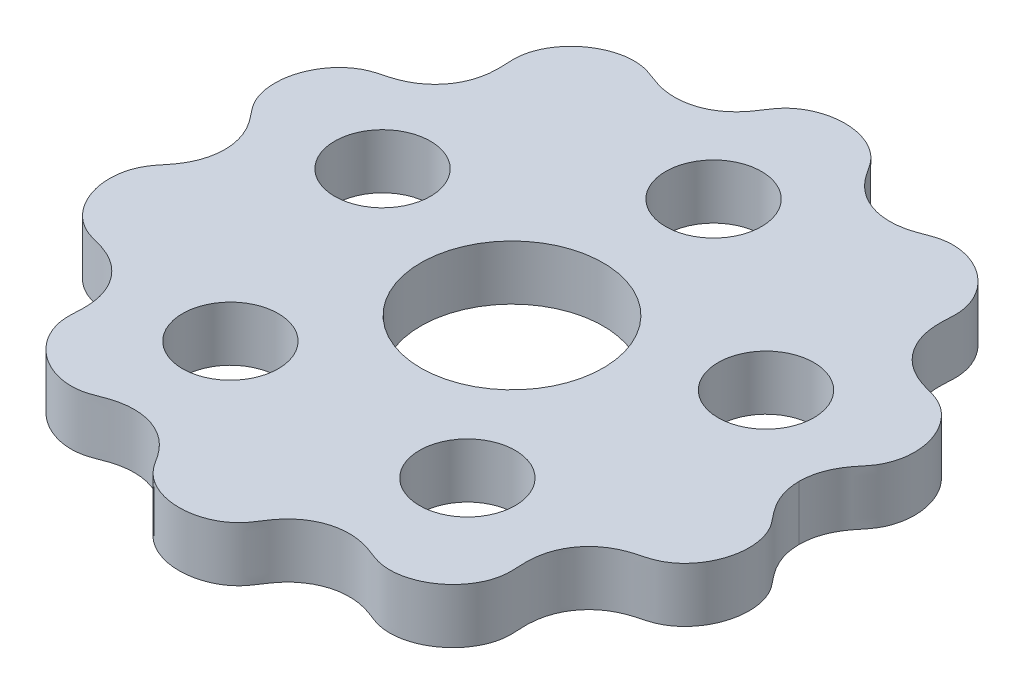
from build123d import *

# Parameters (mm, degrees)
BOSS_EXTRUDE2_DEPTH = 6
SKETCH8_R           = 5.25
SKETCH8_R_2         = 10
CUT_EXTRUDE1_DEPTH  = 15


# Read off the part's stored shape, not the designer's step: Boss-Extrude2
with BuildPart() as part:
    # Boss-Extrude2 outline → Boss-Extrude2 (new body)
    with BuildSketch(Plane(origin=(0, 0, 0), x_dir=(1, 0, 0), z_dir=(0, 1, 0))):
        with BuildLine():
            add(Edge.make_bspline(
                [(-31.499993504, 0), (-31.499993419, -0.00604861), (-31.50038656, -0.331222159), (-31.543529646, -0.975447868), (-31.720841141, -1.86242283), (-32.141813755, -2.935555351), (-32.690034798, -3.873745201), (-33.307897052, -4.685007547), (-33.913183196, -5.38319735), (-34.361423558, -6.084216031), (-34.663951399, -6.753375858), (-34.861884865, -7.360852844), (-35.040837742, -8.200861452), (-35.112861284, -9.280386882), (-34.96942898, -10.589620807), (-34.484356858, -12.060394501), (-33.812574702, -13.2069754), (-33.091935075, -14.043880698), (-32.433167143, -14.613787937), (-31.906553334, -14.97837614), (-31.259202182, -15.328922299), (-30.476556206, -15.611601701), (-29.576048481, -15.817978522), (-28.603486754, -16.125966833), (-27.615334966, -16.579365945), (-26.654208043, -17.219734538), (-25.779503529, -18.059248358), (-25.049455366, -19.096428499), (-24.555617668, -20.192114936), (-24.274390159, -21.290953441), (-24.169343307, -22.362975244), (-24.194048583, -23.3818518), (-24.272277679, -24.297501934), (-24.22204854, -25.118528202), (-24.077190933, -25.823973525), (-23.888393636, -26.414977622), (-23.624178999, -27.020042218), (-23.278791803, -27.629537082), (-22.732658436, -28.38965416), (-21.922352281, -29.225019964), (-20.825187152, -30.015729577), (-19.615201803, -30.548970617), (-18.55366793, -30.805984952), (-17.682998284, -30.886193311), (-17.024199682, -30.873951656), (-16.280427126, -30.776191349), (-15.472502635, -30.541053046), (-14.618367559, -30.176668488), (-13.64975963, -29.855600754), (-12.574174193, -29.641503211), (-11.401229274, -29.598214263), (-10.175069451, -29.776019818), (-8.948580224, -30.212814968), (-7.894719665, -30.83925516), (-7.025705572, -31.589359041), (-6.320984457, -32.412458415), (-5.757258901, -33.258730106), (-5.273058589, -34.043636024), (-4.725893182, -34.66763204), (-4.053271763, -35.250077039), (-3.204594881, -35.791325942), (-2.078426192, -36.257650554), (-0.847460094, -36.497301275), (0.277775766, -36.523106962), (1.412122853, -36.392471929), (2.310868949, -36.155991526), (3.130672847, -35.810642797), (3.856106157, -35.373648518), (4.346805755, -35.005036367), (4.865006719, -34.522072188), (5.371511978, -33.896516796), (5.835413279, -33.129593461), (6.398728076, -32.313866645), (7.094167258, -31.523769895), (7.945813189, -30.806623471), (8.978669327, -30.201322987), (10.18580069, -29.774506124), (11.401172088, -29.598195906), (12.574210653, -29.641514683), (13.649734591, -29.855593263), (14.618384312, -30.176672775), (15.472494021, -30.541052054), (16.280430851, -30.776190175), (17.02419909, -30.873955043), (17.682996136, -30.886186775), (18.553673497, -30.805997522), (19.615190622, -30.548947207), (20.825207419, -30.015770951), (22.081497826, -29.110228874), (22.968958631, -28.128296522), (23.546146407, -27.198942866), (23.888371532, -26.414933393), (24.077203873, -25.823999416), (24.222040012, -25.118511141), (24.272284078, -24.297514737), (24.194044591, -23.381843813), (24.16934539, -22.362979412), (24.274389118, -21.290951357), (24.555618274, -20.192116148), (25.049454993, -19.096427752), (25.779503766, -18.059248834), (26.654207893, -17.219734238), (27.615335064, -16.579366141), (28.603486687, -16.1259667), (29.576048527, -15.817978613), (30.476556179, -15.611601649), (31.259202197, -15.328922327), (31.906553325, -14.978376124), (32.43316715, -14.613787947), (33.091935066, -14.043880688), (33.812574717, -13.206975413), (34.484356834, -12.060394481), (34.969429016, -10.589620836), (35.112861237, -9.280386846), (35.040837808, -8.200861503), (34.86188476, -7.360852764), (34.663951614, -6.753376022), (34.36142315, -6.08421572), (33.913183962, -5.383197934), (33.307895638, -4.68500647), (32.690036895, -3.873746798), (32.141810592, -2.935552943), (31.720845785, -1.862426365), (31.543525655, -0.975444663), (31.500386236, -0.331221533), (31.499994445, -0.006048791), (31.499994555, 0)],
                knots=[0.115426791, 0.115426791, 0.115426791, 0.115426791, 0.115426791, 0.115579116, 0.123615817, 0.131652517, 0.13806522, 0.144477922, 0.150890625, 0.157303327, 0.161318066, 0.165332805, 0.169347544, 0.173362283, 0.182908916, 0.192455548, 0.202269911, 0.212084274, 0.216110468, 0.220136661, 0.224162855, 0.228189049, 0.234599883, 0.241010717, 0.247421551, 0.253832385, 0.261894552, 0.269956719, 0.27776685, 0.28557698, 0.291986229, 0.298395477, 0.304804726, 0.311213975, 0.315112418, 0.319010861, 0.322909305, 0.326807748, 0.331713694, 0.336619639, 0.34643153, 0.355979871, 0.365528211, 0.369669846, 0.373811481, 0.377953116, 0.382094751, 0.388507083, 0.394919415, 0.401331747, 0.40774408, 0.416038981, 0.424333883, 0.432328324, 0.440322764, 0.446722382, 0.453122, 0.459521617, 0.465921235, 0.469914746, 0.473908258, 0.48189528, 0.491151437, 0.500407593, 0.505268423, 0.510129254, 0.519850916, 0.523707887, 0.527564857, 0.531421828, 0.535278799, 0.541512909, 0.547747018, 0.553981128, 0.560215238, 0.567940672, 0.575666107, 0.583961009, 0.59225591, 0.598668243, 0.605080575, 0.611492907, 0.617905239, 0.622046874, 0.626188509, 0.630330144, 0.634471779, 0.644020119, 0.65356846, 0.663380351, 0.673192242, 0.677090685, 0.680989129, 0.684887572, 0.688786015, 0.695195264, 0.701604513, 0.708013761, 0.71442301, 0.72223314, 0.730043271, 0.738105438, 0.746167605, 0.752578439, 0.758989273, 0.765400107, 0.771810941, 0.775837135, 0.779863329, 0.783889522, 0.787915716, 0.797730079, 0.807544442, 0.817091074, 0.826637707, 0.830652446, 0.834667185, 0.838681924, 0.842696663, 0.849109365, 0.855522068, 0.86193477, 0.868347472, 0.876384173, 0.884420874, 0.884573204, 0.884573204, 0.884573204, 0.884573204, 0.884573204], degree=4))
            add(Edge.make_bspline(
                [(31.499994555, 0), (31.499994445, 0.006048791), (31.500386236, 0.331221533), (31.543525655, 0.975444663), (31.720845785, 1.862426365), (32.141810592, 2.935552943), (32.690036895, 3.873746798), (33.307895638, 4.68500647), (33.913183962, 5.383197934), (34.36142315, 6.08421572), (34.663951614, 6.753376022), (34.86188476, 7.360852764), (35.040837808, 8.200861503), (35.112861237, 9.280386846), (34.969429016, 10.589620836), (34.484356834, 12.060394481), (33.812574717, 13.206975413), (33.091935066, 14.043880688), (32.43316715, 14.613787947), (31.906553325, 14.978376124), (31.259202197, 15.328922327), (30.476556179, 15.611601649), (29.576048527, 15.817978613), (28.603486687, 16.1259667), (27.615335064, 16.579366141), (26.654207893, 17.219734238), (25.779503766, 18.059248834), (25.049454993, 19.096427752), (24.555618274, 20.192116148), (24.274389118, 21.290951357), (24.16934539, 22.362979412), (24.194044591, 23.381843813), (24.272284078, 24.297514737), (24.222040012, 25.118511141), (24.077203873, 25.823999416), (23.888371532, 26.414933393), (23.546146407, 27.198942866), (22.968958631, 28.128296522), (22.081497826, 29.110228874), (20.825207419, 30.015770951), (19.615190622, 30.548947207), (18.553673497, 30.805997522), (17.682996136, 30.886186775), (17.02419909, 30.873955043), (16.280430851, 30.776190175), (15.472494021, 30.541052054), (14.618384312, 30.176672775), (13.649734591, 29.855593263), (12.574210653, 29.641514683), (11.401172088, 29.598195906), (10.18580069, 29.774506124), (8.978669327, 30.201322987), (7.945813189, 30.806623471), (7.094167258, 31.523769895), (6.398728076, 32.313866645), (5.835413279, 33.129593461), (5.371511978, 33.896516796), (4.865006719, 34.522072188), (4.346805755, 35.005036367), (3.856106157, 35.373648518), (3.130672847, 35.810642797), (2.310868949, 36.155991526), (1.412122853, 36.392471929), (0.277775766, 36.523106962), (-0.847460094, 36.497301275), (-2.078426192, 36.257650554), (-3.204594881, 35.791325942), (-4.053271763, 35.250077039), (-4.725893182, 34.66763204), (-5.273058589, 34.043636024), (-5.757258901, 33.258730106), (-6.320984457, 32.412458415), (-7.025705572, 31.589359041), (-7.894719665, 30.83925516), (-8.948580224, 30.212814968), (-10.175069451, 29.776019818), (-11.401229274, 29.598214263), (-12.574174193, 29.641503211), (-13.64975963, 29.855600754), (-14.618367559, 30.176668488), (-15.472502635, 30.541053046), (-16.280427126, 30.776191349), (-17.024199682, 30.873951656), (-17.682998284, 30.886193311), (-18.55366793, 30.805984952), (-19.615201803, 30.548970617), (-20.825187152, 30.015729577), (-21.922352281, 29.225019964), (-22.732658436, 28.38965416), (-23.278791803, 27.629537082), (-23.624178999, 27.020042218), (-23.888393636, 26.414977622), (-24.077190933, 25.823973525), (-24.22204854, 25.118528202), (-24.272277679, 24.297501934), (-24.194048583, 23.3818518), (-24.169343307, 22.362975244), (-24.274390159, 21.290953441), (-24.555617668, 20.192114936), (-25.049455366, 19.096428499), (-25.779503529, 18.059248358), (-26.654208043, 17.219734538), (-27.615334966, 16.579365945), (-28.603486754, 16.125966833), (-29.576048481, 15.817978522), (-30.476556206, 15.611601701), (-31.259202182, 15.328922299), (-31.906553334, 14.97837614), (-32.433167143, 14.613787937), (-33.091935075, 14.043880698), (-33.812574702, 13.2069754), (-34.484356858, 12.060394501), (-34.96942898, 10.589620807), (-35.112861284, 9.280386882), (-35.040837742, 8.200861452), (-34.861884865, 7.360852844), (-34.663951399, 6.753375858), (-34.361423558, 6.084216031), (-33.913183196, 5.38319735), (-33.307897052, 4.685007547), (-32.690034798, 3.873745201), (-32.141813755, 2.935555351), (-31.720841141, 1.86242283), (-31.543529646, 0.975447868), (-31.50038656, 0.331222159), (-31.499993419, 0.00604861), (-31.499993504, 0)],
                knots=[0.115426791, 0.115426791, 0.115426791, 0.115426791, 0.115426791, 0.115579121, 0.123615822, 0.131652523, 0.138065225, 0.144477927, 0.15089063, 0.157303332, 0.161318071, 0.16533281, 0.169347549, 0.173362288, 0.182908921, 0.192455553, 0.202269916, 0.212084279, 0.216110473, 0.220136666, 0.22416286, 0.228189054, 0.234599888, 0.241010722, 0.247421556, 0.25383239, 0.261894557, 0.269956724, 0.277766855, 0.285576985, 0.291986234, 0.298395482, 0.304804731, 0.31121398, 0.315112423, 0.319010866, 0.32290931, 0.326807753, 0.336619644, 0.346431535, 0.355979876, 0.365528216, 0.369669851, 0.373811486, 0.377953121, 0.382094756, 0.388507088, 0.39491942, 0.401331752, 0.407744085, 0.416038986, 0.424333888, 0.432059322, 0.439784757, 0.446018867, 0.452252977, 0.458487086, 0.464721196, 0.468578167, 0.472435137, 0.476292108, 0.480149079, 0.489870741, 0.494731572, 0.499592402, 0.508848558, 0.518104715, 0.526091737, 0.530085249, 0.53407876, 0.540478378, 0.546877995, 0.553277613, 0.559677231, 0.567671671, 0.575666112, 0.583961014, 0.592255915, 0.598668248, 0.60508058, 0.611492912, 0.617905244, 0.622046879, 0.626188514, 0.630330149, 0.634471784, 0.644020124, 0.653568465, 0.663380356, 0.668286301, 0.673192247, 0.67709069, 0.680989134, 0.684887577, 0.68878602, 0.695195269, 0.701604518, 0.708013766, 0.714423015, 0.722233145, 0.730043276, 0.738105443, 0.74616761, 0.752578444, 0.758989278, 0.765400112, 0.771810946, 0.77583714, 0.779863334, 0.783889527, 0.787915721, 0.797730084, 0.807544447, 0.817091079, 0.826637712, 0.830652451, 0.83466719, 0.838681929, 0.842696668, 0.84910937, 0.855522073, 0.861934775, 0.868347477, 0.876384178, 0.884420879, 0.884573204, 0.884573204, 0.884573204, 0.884573204, 0.884573204], degree=4))
        make_face()
    extrude(amount=BOSS_EXTRUDE2_DEPTH)

    # Sketch8 → Cut-Extrude1 (cut)
    with BuildSketch(Plane(origin=(0, 6, 0), x_dir=(1, 0, 0), z_dir=(0, 1, 0))):
        with Locations(Location((-21.024568871, 6.831245518, 0), (0, 0, 270))):
            Circle(SKETCH8_R)
        with Locations(Location((0, 0, 0), (0, 0, 270))):
            Circle(SKETCH8_R_2)
        with Locations(Location((-4.8516e-05, 22.106524185, 0), (0, 0, 270))):
            Circle(SKETCH8_R)
        with Locations(Location((21.024538886, 6.831337801, 0), (0, 0, 270))):
            Circle(SKETCH8_R)
        with Locations(Location((12.993928145, -17.884525235, 0), (0, 0, 270))):
            Circle(SKETCH8_R)
        with Locations(Location((-12.993849645, -17.884582269, 0), (0, 0, 270))):
            Circle(SKETCH8_R)
    extrude(amount=-CUT_EXTRUDE1_DEPTH, mode=Mode.SUBTRACT)


solid = part.part
